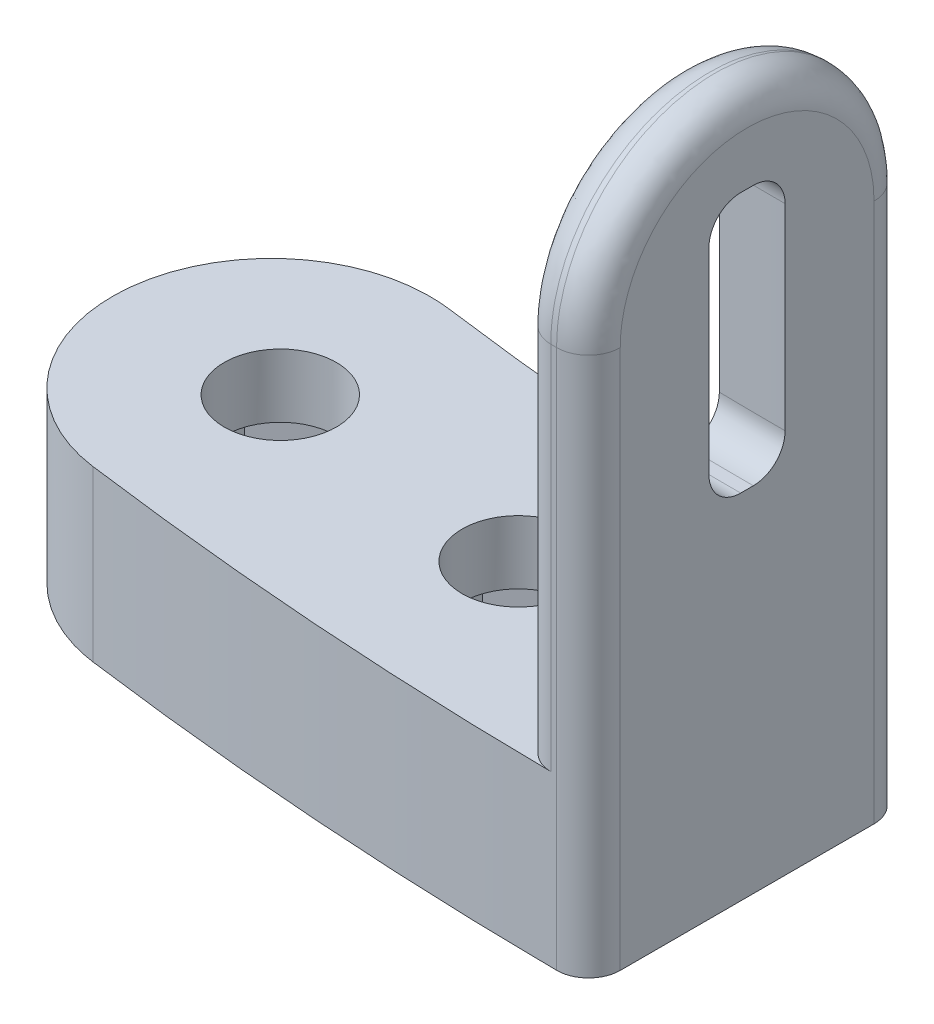
from build123d import *

# Parameters (mm, degrees)
EXTRUDE_1_DEPTH     = 8
EXTRUDE_2_DEPTH     = 25
HOLE_WIZARD_M5_1_D  = 5.3
FILLET_1_R          = 7.5
FILLET_2_DEPTH      = 8
SKETCH_5_W          = 3.5999999999999943
SKETCH_5_H          = 12.29999999986595
FILLET_3_R          = 1.5
FILLET_4_R          = 1.5
CUT_EXTRUDE_1_DEPTH = 5


with BuildPart() as part:
    # 草图1 → 凸台-拉伸1 (new body)
    with BuildSketch(Plane(origin=(0, 0, 0), x_dir=(1, 0, 0), z_dir=(0, 1, 0))):
        with BuildLine():
            Line((2.098e-14, -189), (1.932e-14, -174.00000000000003))
            ThreePointArc((2.28618e-12, -174.00000000000003), (-15.165099238093463, -173.33787746796366), (-30.214782914050144, -171.35654902412347))
            Line((-30.214782914045937, -171.35654902412418), (-32.8195055790499, -186.12866531930732))
            ThreePointArc((-32.81950557905, -186.12866531930732), (-16.472435379307413, -188.28079793933995), (-3.472e-14, -189.00000000000003))
        make_face()
    extrude(amount=EXTRUDE_1_DEPTH)

    # 草图4 → 凸台-拉伸2 (add)
    with BuildSketch(Plane(origin=(0, 8, 0), x_dir=(1, 0, 0), z_dir=(0, 1, 0))):
        with BuildLine():
            Line((2.082e-14, -189), (1.916e-14, -174))
            ThreePointArc((-3.196e-14, -174.00000000000003), (-1.5184171767173116, -173.99337461316583), (-3.0367187200877925, -173.9734989572121))
            Line((-3.036718720087315, -173.97349895721206), (-3.298504816646567, -188.97121438455795))
            ThreePointArc((-3.2985048166465822, -188.971214384558), (-1.6493152091926062, -188.99280345912842), (-3.472e-14, -189.00000000000006))
        make_face()
    extrude(amount=EXTRUDE_2_DEPTH)

    # M5 间隙孔1 (through all)
    with Locations(Plane(origin=(0, 8, 0), x_dir=(1, 0, 0), z_dir=(0, 1, 0))):
        with Locations((-23.608051681, -179.958078162), (-11.163314825, -181.156370029)):
            Hole(HOLE_WIZARD_M5_1_D / 2)

    # 圆角1
    # the kernel refuses this fillet: 7.5 mm, written as the material it takes off along each edge
    with BuildSketch(Plane(origin=(1.47232e-12, 33, -1.0760459e-10), x_dir=(0.10755019962978496, 0, 0.9941996552803635), z_dir=(0.9941996552803635, 0, -0.10755019962978496))) as fillet_1_piece_1:
        with BuildLine():
            CenterArc((174.00000000010766 + FILLET_1_R, FILLET_1_R), FILLET_1_R, 180, 89.99999999999977)
            Line((174.00000000010766 + FILLET_1_R, 0), (174.00000000010766, 0))
            Line((174.00000000010766, 0), (174.00000000010766, FILLET_1_R))
        make_face()
    fillet_1_piece_1_solid = revolve(axis=Axis((1.47232e-12, 33, -1.0760459e-10), (0, -1, 0)), revolution_arc=13.348228955549553, mode=Mode.PRIVATE)
    with BuildSketch(Plane(origin=(2.05469e-12, 33, -2.9481839e-10), x_dir=(-0.11639521392683701, 0, 0.9932029773288671), z_dir=(-0.9932029773288671, 0, -0.11639521392683701))) as fillet_1_piece_2:
        with BuildLine():
            CenterArc((189.0000000002949 - FILLET_1_R, -FILLET_1_R), FILLET_1_R, 0, 89.99999999999957)
            Line((189.0000000002949 - FILLET_1_R, 0), (189.0000000002949, 0))
            Line((189.0000000002949, 0), (189.00000000029488, -FILLET_1_R))
        make_face()
    fillet_1_piece_2_solid = revolve(axis=Axis((2.05469e-12, 33, -2.9481839e-10), (0, 1, 0)), revolution_arc=12.368210784462358, mode=Mode.PRIVATE)
    add([fillet_1_piece_1_solid, fillet_1_piece_2_solid], mode=Mode.SUBTRACT)

    # 圆角2: read off the stored shape, not the designer's step
    # 圆角2 outline → 圆角2 (cut)
    with BuildSketch(Plane(origin=(0, 0, 0), x_dir=(1, 0, 0), z_dir=(0, 1, 0))):
        with BuildLine():
            ThreePointArc((-32.819505579, -186.128665319), (-28.966041771, -186.767150281), (-25.100206236, -187.325864863))
            add(Edge.make_bspline(
                [(-25.100206236, -187.325864863), (-27.006863278382305, -187.07038767754574), (-29.132080374521447, -186.17341393049847), (-31.048536919413714, -184.35464406978926), (-32.02623112721157, -181.62978297542463), (-31.490224503, -178.589937725)],
                knots=[0, 0, 0, 0, 0, 0, 0.5103349834155644, 0.5103349834155644, 0.5103349834155644, 0.5103349834155644, 0.5103349834155644, 0.5103349834155644], degree=5, weights=[1, 0.7958660065557144, 0.6438203721908997, 0.5438630969055563, 0.4959941806996843, 0.5002136235732837]))
            Line((-31.490224503, -178.589937725), (-32.819505579, -186.128665319))
        make_face()
        with BuildLine():
            Line((-30.214782914, -171.356549024), (-31.490224503, -178.589937725))
            add(Edge.make_bspline(
                [(-31.490224503, -178.589937725), (-30.984360135627078, -175.72103774319677), (-29.29551148466263, -173.58668082656104), (-27.075163325391554, -172.48015181385665), (-24.918748626576246, -172.21612345785414), (-23.108126376, -172.458732732)],
                knots=[0.5103349834155644, 0.5103349834155644, 0.5103349834155644, 0.5103349834155644, 0.5103349834155644, 0.5103349834155644, 1, 1, 1, 1, 1, 1], degree=5, weights=[0.5002136235732837, 0.5042621674352976, 0.5562650770089762, 0.6562223522943196, 0.8041339932913276, 1]))
            ThreePointArc((-23.108126376, -172.458732732), (-26.667149567, -171.944360576), (-30.214782914, -171.356549024))
        make_face()
    extrude(amount=FILLET_2_DEPTH, mode=Mode.SUBTRACT)

    # 草图5 → 切除-旋转1 (revolve, cut)
    with BuildSketch(Plane(origin=(0, 0, 0), x_dir=(-0.01745240643728342, 0, 0.9998476951563913), z_dir=(-0.9998476951563913, 0, -0.01745240643728342))):
        with Locations((181.5, 22.85000000006228)):
            Rectangle(SKETCH_5_W, SKETCH_5_H)
    revolve(axis=Axis((0, 55.00000000000001, 0), (0, -1, 0)), mode=Mode.SUBTRACT)

    # 圆角3
    fillet_3_edges = [part.edges().sort_by_distance(p)[0] for p in [
        (-1.5995739568519802, 28.999999999995254, 183.2930204976626),
        (-1.5995739568519802, 16.700000000129307, 183.2930204976626),
        (-1.5681584290578334, 16.700000000129307, 179.6931575746316),
        (-1.5681584290578334, 28.999999999995254, 179.6931575746316),
    ]]
    fillet(fillet_3_edges, radius=FILLET_3_R)

    # 圆角4
    fillet_4_edges = [part.edges().sort_by_distance(p)[0] for p in [
        (-8.43e-15, 12.75, 189.00000000000003),
        (-3.2985048166465747, 16.75, 188.97121438455798),
        (-3.0367187200875536, 16.75, 173.9734989572121),
        (7.049e-13, 12.75, 174.00000000000003),
        (-1.5838661929561955, 33, 181.4930890361471),
        (-1.5838661929561955, 33, 181.4930890361471),
    ]]
    fillet(fillet_4_edges, radius=FILLET_4_R)

    # 草图6 → 切除-拉伸1 (cut)
    with BuildSketch(Plane.XZ):
        Polygon((-23.608051681342314, 175.33927600862347), (-19.608051681342303, 177.648677085382), (-19.608051681342303, 182.267479238899), (-23.608051681342307, 184.5768803156575), (-27.608051681342282, 182.267479238899), (-27.608051681342282, 177.64867708538196), align=None)
        Polygon((-11.163314825368905, 176.53756787555398), (-7.163314825368916, 178.84696895231247), (-7.163314825368916, 183.4657711058294), (-11.163314825368891, 185.7751721825879), (-15.16331482536884, 183.46577110582942), (-15.16331482536884, 178.84696895231244), align=None)
    extrude(amount=-CUT_EXTRUDE_1_DEPTH, mode=Mode.SUBTRACT)


solid = part.part
